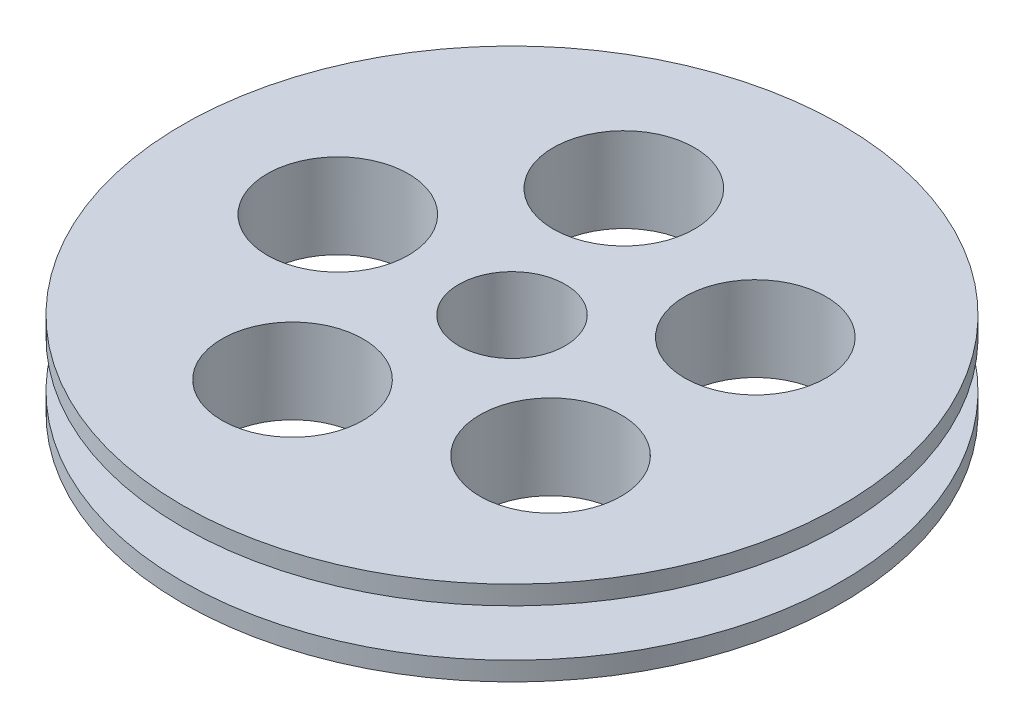
from build123d import *

# Parameters (mm, degrees)
SKETCH3_R          = 5.653749864
SKETCH3_R_2        = 7.5
CUT_EXTRUDE1_DEPTH = 10


with BuildPart() as part:
    # Sketch1 → Revolve4 (revolve)
    with BuildSketch(Plane(origin=(0, 0, 0), x_dir=(0, 0, -1), z_dir=(1, 0, 0))):
        Polygon((0, -2), (30, -2), (30, 0), (22, 0), (22, 5), (30, 5), (30, 7), (0, 7), align=None)
    revolve(axis=Axis((0, 2.5, 5), (0, 1, 0)))

    # Sketch3 → Cut-Extrude1 (cut)
    with BuildSketch(Plane(origin=(0, 7, 0), x_dir=(1, 0, 0), z_dir=(0, 1, 0))):
        with Locations((0, -5)):
            Circle(SKETCH3_R)
        with Locations((-18.5, -5)):
            Circle(SKETCH3_R_2)
        with Locations((-5.716814396, 12.594545551)):
            Circle(SKETCH3_R_2)
        with Locations((14.966814396, 5.874027167)):
            Circle(SKETCH3_R_2)
        with Locations((14.966814396, -15.874027167)):
            Circle(SKETCH3_R_2)
        with Locations((-5.716814396, -22.594545551)):
            Circle(SKETCH3_R_2)
    extrude(amount=-CUT_EXTRUDE1_DEPTH, mode=Mode.SUBTRACT)


solid = part.part
